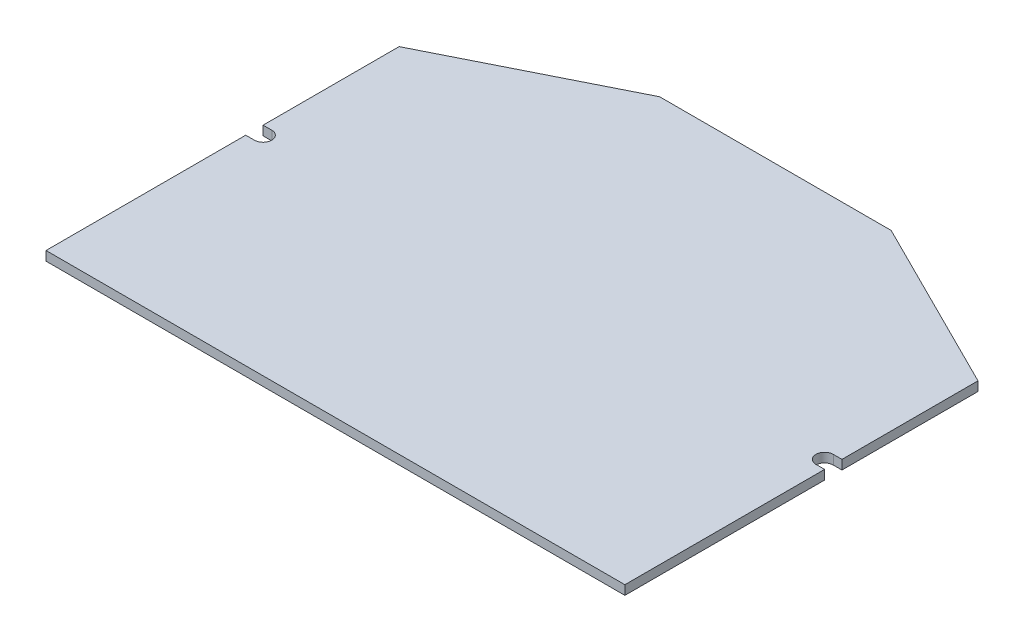
from build123d import *

# Parameters (mm, degrees)
BOSS_EXTRUDE1_DEPTH = 1.6


with BuildPart() as part:
    # Sketch1 → Boss-Extrude1 (new body)
    with BuildSketch(Plane(origin=(0, 0, 0), x_dir=(1, 0, 0), z_dir=(0, 1, 0))):
        with BuildLine():
            Line((-50, 65), (-20, 80))
            Line((-20, 80), (0, 80))
            Line((0, 80), (0, 4))
            Line((0, 4), (-50, 4))
            Line((-50, 4), (-50, 38.5))
            Line((-50, 38.5), (-48.5, 38.5))
            ThreePointArc((-48.5, 38.5), (-47, 40), (-48.5, 41.5))
            Line((-48.5, 41.5), (-50, 41.5))
            Line((-50, 41.5), (-50, 65))
        make_face()
    boss_extrude1 = extrude(amount=BOSS_EXTRUDE1_DEPTH)

    # Mirror1: Boss-Extrude1 across plane
    add(boss_extrude1.mirror(Plane(origin=(0, 1.6, -4), x_dir=(0, 0, 1), z_dir=(-1, 0, 0))))


solid = part.part
